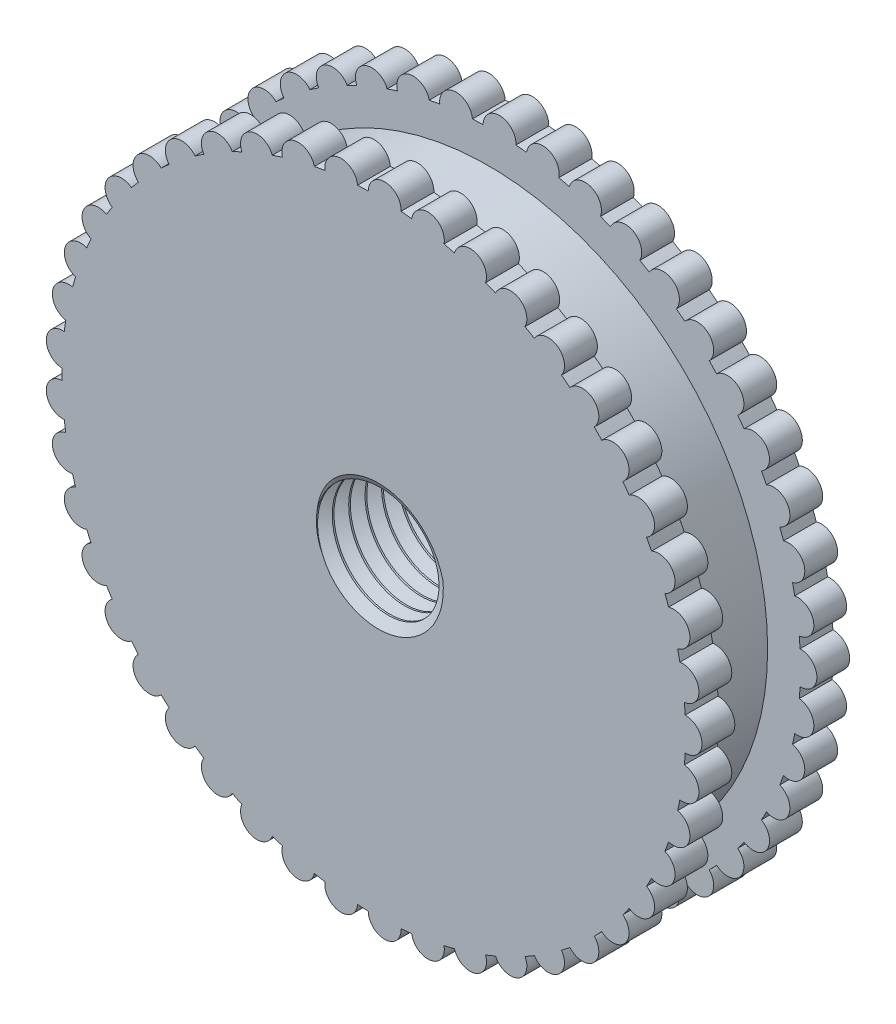
from build123d import *

# Parameters (mm, degrees)
SKETCH1_R               = 9.5
SKETCH1_R_2             = 1.75
BOSS_EXTRUDE1_DEPTH     = 4.5
CUT_SWEEP1_PITCH        = 0.5
CUT_EXTRUDE1_DEPTH      = 1.25
CUT_EXTRUDE1_DEPTH_BACK = 1.25
SKETCH4_R               = 11.115161563
SKETCH4_R_2             = 8.5
BOSS_EXTRUDE2_START     = -1
BOSS_EXTRUDE2_DEPTH     = 1
MIRROR3_OUTLINE_R       = 0.5
MIRROR3_DEPTH           = 3.5
SKETCH6_R               = 18.5
SKETCH6_R_2             = 8.5
CUT_EXTRUDE2_DEPTH      = 2.5


with BuildPart() as part:
    # Sketch1 → Boss-Extrude1 (new body)
    with BuildSketch(Plane.XY):
        Circle(SKETCH1_R)
        Circle(SKETCH1_R_2, mode=Mode.SUBTRACT)
    extrude(amount=BOSS_EXTRUDE1_DEPTH)

    # Cut-Sweep1: arcs per turn and ends read off the stored shape
    # Cut-Sweep1: the profile of Sketch3 screwed along a right-hand helix through 10.666667 turns, 6 arcs to a turn; built about Z, then put on its axis
    cut_sweep1_z = Axis((0, 0, 0), (0, 0, 1))
    cut_sweep1_corners = [(1.721968786, 0.010306382, -0.726649181), (1.721968786, -0.01149805, -0.247144679), (2.13766098, -0.000595834, -0.48689693)]
    with BuildLine(mode=Mode.PRIVATE) as cut_sweep1_profile:
        Line(cut_sweep1_corners[0], cut_sweep1_corners[1])
        Line(cut_sweep1_corners[1], cut_sweep1_corners[2])
        Line(cut_sweep1_corners[2], cut_sweep1_corners[0])
    cut_sweep1_cap = Face(cut_sweep1_profile.wire())
    cut_sweep1_turn_angles = [0, 30, 60, 90, 120, 150, 180, 210, 240, 270, 300, 330, 360]
    cut_sweep1_turn_weights = [1, 0.8660254037844387, 1, 0.8660254037844387, 1, 0.8660254037844387, 1, 0.8660254037844387, 1, 0.8660254037844387, 1, 0.8660254037844387, 1]
    cut_sweep1_turn_rails = [Edge.make_bspline([Vector(p[0], p[1], 0).rotate(cut_sweep1_z, cut_sweep1_turn_angles[k]) / cut_sweep1_turn_weights[k] + Vector(0, 0, p[2] + CUT_SWEEP1_PITCH * cut_sweep1_turn_angles[k] / 360) for k in range(13)], [0, 0, 0, 1, 1, 2, 2, 3, 3, 4, 4, 5, 5, 6, 6, 6], 2, cut_sweep1_turn_weights) for p in cut_sweep1_corners]
    cut_sweep1_turn_sides = [Face.make_surface_from_curves(cut_sweep1_turn_rails[p[0]], cut_sweep1_turn_rails[p[1]]) for p in [(0, 1), (1, 2), (2, 0)]]
    cut_sweep1_last_angles = [3600, 3630, 3660, 3690, 3720, 3750, 3780, 3810, 3840]
    cut_sweep1_last_weights = [1, 0.8660254037844387, 1, 0.8660254037844387, 1, 0.8660254037844387, 1, 0.8660254037844387, 1]
    cut_sweep1_last_rails = [Edge.make_bspline([Vector(p[0], p[1], 0).rotate(cut_sweep1_z, cut_sweep1_last_angles[k]) / cut_sweep1_last_weights[k] + Vector(0, 0, p[2] + CUT_SWEEP1_PITCH * cut_sweep1_last_angles[k] / 360) for k in range(9)], [0, 0, 0, 1, 1, 2, 2, 3, 3, 4, 4, 4], 2, cut_sweep1_last_weights) for p in cut_sweep1_corners]
    cut_sweep1_last_sides = [Face.make_surface_from_curves(cut_sweep1_last_rails[p[0]], cut_sweep1_last_rails[p[1]]) for p in [(0, 1), (1, 2), (2, 0)]]
    cut_sweep1 = Plane(origin=(0, 0, 4.5), x_dir=(1, 0, 0), z_dir=(0, 0, -1)) * Solid(Shell([*[p.moved(Location((0, 0, CUT_SWEEP1_PITCH * i))) for i in range(10) for p in cut_sweep1_turn_sides], *cut_sweep1_last_sides, cut_sweep1_cap, cut_sweep1_cap.rotate(cut_sweep1_z, 3840).moved(Location((0, 0, CUT_SWEEP1_PITCH * 3840 / 360)))]))
    add(cut_sweep1, mode=Mode.SUBTRACT)

    # Sketch4 → Cut-Extrude1 (cut, two sides: drawn at the far end of the back side and taken through both)
    with BuildSketch(Plane.XY.offset(2.25).offset(-CUT_EXTRUDE1_DEPTH_BACK)):
        Circle(SKETCH4_R)
        Circle(SKETCH4_R_2, mode=Mode.SUBTRACT)
    extrude(amount=CUT_EXTRUDE1_DEPTH + CUT_EXTRUDE1_DEPTH_BACK, mode=Mode.SUBTRACT)

    # Boss-Extrude2: read off the stored shape, not the designer's step
    # Boss-Extrude2 outline → Boss-Extrude2 (add)
    with BuildSketch(Plane.XY.offset(4.5).offset(BOSS_EXTRUDE2_START)):
        with BuildLine():
            ThreePointArc((9.486842105, 0.49982684), (9.5, 0), (9.486842105, -0.49982684))
            ThreePointArc((9.486842105, -0.49982684), (10, 0), (9.486842105, 0.49982684))
        make_face()
        with BuildLine():
            ThreePointArc((9.324954359, -1.815275793), (9.902680687, -1.391731009), (9.464079261, -0.825350675))
            ThreePointArc((9.464079261, -0.825350675), (9.407546653, -1.322144459), (9.324954359, -1.815275793))
        make_face()
        with BuildLine():
            ThreePointArc((9.324954359, 1.815275793), (9.407546653, 1.322144459), (9.464079261, 0.825350675))
            ThreePointArc((9.464079261, 0.825350675), (9.902680687, 1.391731009), (9.324954359, 1.815275793))
        make_face()
        with BuildLine():
            ThreePointArc((8.981566983, -3.095392469), (9.612616959, -2.756373558), (9.25710888, -2.134463677))
            ThreePointArc((9.25710888, -2.134463677), (9.131986111, -2.61855488), (8.981566983, -3.095392469))
        make_face()
        with BuildLine():
            ThreePointArc((8.981566983, 3.095392469), (9.131986111, 2.61855488), (9.25710888, 2.134463677))
            ThreePointArc((9.25710888, 2.134463677), (9.612616959, 2.756373558), (8.981566983, 3.095392469))
        make_face()
        with BuildLine():
            ThreePointArc((8.463363622, -4.31526085), (9.135454576, -4.06736643), (8.869959404, -3.402031772))
            ThreePointArc((8.869959404, -3.402031772), (8.678681848, -3.863998109), (8.463363622, -4.31526085))
        make_face()
        with BuildLine():
            ThreePointArc((8.463363622, 4.31526085), (8.678681848, 3.863998109), (8.869959404, 3.402031772))
            ThreePointArc((8.869959404, 3.402031772), (9.135454576, 4.06736643), (8.463363622, 4.31526085))
        make_face()
        with BuildLine():
            ThreePointArc((7.780430515, -5.451137588), (8.480480962, -5.299192642), (8.310166257, -4.603383188))
            ThreePointArc((8.310166257, -4.603383188), (8.056456914, -5.03423301), (7.780430515, -5.451137588))
        make_face()
        with BuildLine():
            ThreePointArc((7.780430515, 5.451137588), (8.056456914, 5.03423301), (8.310166257, 4.603383188))
            ThreePointArc((8.310166257, 4.603383188), (8.480480962, 5.299192642), (7.780430515, 5.451137588))
        make_face()
        with BuildLine():
            ThreePointArc((6.946060178, -6.480914133), (7.660444431, -6.427876097), (7.588625177, -5.715134987))
            ThreePointArc((7.588625177, -5.715134987), (7.27742221, -6.106482292), (6.946060178, -6.480914133))
        make_face()
        with BuildLine():
            ThreePointArc((6.946060178, 6.480914133), (7.27742221, 6.106482292), (7.588625177, 5.715134987))
            ThreePointArc((7.588625177, 5.715134987), (7.660444431, 6.427876097), (6.946060178, 6.480914133))
        make_face()
        with BuildLine():
            ThreePointArc((5.976492681, -7.384547057), (6.691306064, -7.431448255), (6.71938014, -6.715648184))
            ThreePointArc((6.71938014, -6.715648184), (6.356740761, -7.059875842), (5.976492681, -7.384547057))
        make_face()
        with BuildLine():
            ThreePointArc((5.976492681, 7.384547057), (6.356740761, 7.059875842), (6.71938014, 6.715648184))
            ThreePointArc((6.71938014, 6.715648184), (6.691306064, 7.431448255), (5.976492681, 7.384547057))
        make_face()
        with BuildLine():
            ThreePointArc((4.890599552, -8.144448172), (5.591929035, -8.290375726), (5.719350012, -7.585448928))
            ThreePointArc((5.719350012, -7.585448928), (5.312332583, -7.875856939), (4.890599552, -8.144448172))
        make_face()
        with BuildLine():
            ThreePointArc((4.890599552, 8.144448172), (5.312332583, 7.875856939), (5.719350012, 7.585448928))
            ThreePointArc((5.719350012, 7.585448928), (5.591929035, 8.290375726), (4.890599552, 8.144448172))
        make_face()
        with BuildLine():
            ThreePointArc((3.709516465, -8.745826867), (4.383711468, -8.987940463), (4.607999241, -8.307607537))
            ThreePointArc((4.607999241, -8.307607537), (4.164525895, -8.53854344), (3.709516465, -8.745826867))
        make_face()
        with BuildLine():
            ThreePointArc((3.709516465, 8.745826867), (4.164525895, 8.53854344), (4.607999241, 8.307607537))
            ThreePointArc((4.607999241, 8.307607537), (4.383711468, 8.987940463), (3.709516465, 8.745826867))
        make_face()
        with BuildLine():
            ThreePointArc((2.45623186, -9.176977991), (3.090169943, -9.510565163), (3.406959007, -8.868068016))
            ThreePointArc((3.406959007, -8.868068016), (2.935661446, -9.035036905), (2.45623186, -9.176977991))
        make_face()
        with BuildLine():
            ThreePointArc((2.45623186, 9.176977991), (2.935661446, 9.035036905), (3.406959007, 8.868068015))
            ThreePointArc((3.406959007, 8.868068015), (3.090169943, 9.510565163), (2.45623186, 9.176977991))
        make_face()
        with BuildLine():
            ThreePointArc((1.155139496, -9.429509677), (1.736481776, -9.84807753), (2.13960619, -9.255921637))
            ThreePointArc((2.13960619, -9.255921637), (1.649657687, -9.355673654), (1.155139496, -9.429509677))
        make_face()
        with BuildLine():
            ThreePointArc((1.155139496, 9.429509677), (1.649657687, 9.355673654), (2.13960619, 9.255921637))
            ThreePointArc((2.13960619, 9.255921637), (1.736481776, 9.84807753), (1.155139496, 9.429509677))
        make_face()
        with BuildLine():
            ThreePointArc((-0.168436344, -9.498506683), (0.348994968, -9.99390827), (0.830608374, -9.463619272))
            ThreePointArc((0.830608374, -9.463619272), (0.331545219, -9.494212857), (-0.168436344, -9.498506683))
        make_face()
        with BuildLine():
            ThreePointArc((-0.168436344, 9.498506683), (0.331545219, 9.494212857), (0.830608374, 9.463619272))
            ThreePointArc((0.830608374, 9.463619272), (0.348994968, 9.99390827), (-0.168436344, 9.498506683))
        make_face()
        with BuildLine():
            ThreePointArc((-1.488733763, -9.38262606), (-1.045284633, -9.945218954), (-0.49455629, -9.487118323))
            ThreePointArc((-0.49455629, -9.487118323), (-0.993020401, -9.447958006), (-1.488733763, -9.38262606))
        make_face()
        with BuildLine():
            ThreePointArc((-1.488733763, 9.38262606), (-0.993020401, 9.447958006), (-0.49455629, 9.487118323))
            ThreePointArc((-0.49455629, 9.487118323), (-1.045284633, 9.945218954), (-1.488733763, 9.38262606))
        make_face()
        with BuildLine():
            ThreePointArc((-2.780054672, -9.084123294), (-2.419218956, -9.702957263), (-1.810094979, -9.325961407))
            ThreePointArc((-1.810094979, -9.325961407), (-2.298258008, -9.2178094), (-2.780054672, -9.084123294))
        make_face()
        with BuildLine():
            ThreePointArc((-2.780054672, 9.084123294), (-2.298258008, 9.2178094), (-1.810094979, 9.325961407))
            ThreePointArc((-1.810094979, 9.325961407), (-2.419218956, 9.702957263), (-2.780054672, 9.084123294))
        make_face()
        with BuildLine():
            ThreePointArc((-4.017264979, -8.608808401), (-3.746065934, -9.271838546), (-3.090402227, -8.983285261))
            ThreePointArc((-3.090402227, -8.983285261), (-3.558762637, -8.808246619), (-4.017264979, -8.608808401))
        make_face()
        with BuildLine():
            ThreePointArc((-4.017264979, 8.608808401), (-3.558762637, 8.808246619), (-3.090402227, 8.983285261))
            ThreePointArc((-3.090402227, 8.983285261), (-3.746065934, 9.271838546), (-4.017264979, 8.608808401))
        make_face()
        with BuildLine():
            ThreePointArc((-5.176283793, -7.965932845), (-5, -8.660254038), (-4.310558312, -8.465759685))
            ThreePointArc((-4.310558312, -8.465759685), (-4.75, -8.227241336), (-5.176283793, -7.965932845))
        make_face()
        with BuildLine():
            ThreePointArc((-5.176283793, 7.965932845), (-4.75, 8.227241336), (-4.310558312, 8.465759685))
            ThreePointArc((-4.310558312, 8.465759685), (-5, 8.660254038), (-5.176283793, 7.965932845))
        make_face()
        with BuildLine():
            ThreePointArc((-6.234552131, -7.168009467), (-6.156614753, -7.880107536), (-5.446814282, -7.783457726))
            ThreePointArc((-5.446814282, -7.783457726), (-5.848784016, -7.486102159), (-6.234552131, -7.168009467))
        make_face()
        with BuildLine():
            ThreePointArc((-6.234552131, 7.168009467), (-5.848784016, 7.486102159), (-5.446814282, 7.783457726))
            ThreePointArc((-5.446814282, 7.783457726), (-6.156614753, 7.880107536), (-6.234552131, 7.168009467))
        make_face()
        with BuildLine():
            ThreePointArc((-7.171472004, -6.230568938), (-7.193398004, -6.946583704), (-6.477054208, -6.949659617))
            ThreePointArc((-6.477054208, -6.949659617), (-6.833728103, -6.599254519), (-7.171472004, -6.230568938))
        make_face()
        with BuildLine():
            ThreePointArc((-7.171472004, 6.230568938), (-6.833728103, 6.599254519), (-6.477054208, 6.949659617))
            ThreePointArc((-6.477054208, 6.949659617), (-7.193398004, 6.946583704), (-7.171472004, 6.230568938))
        make_face()
        with BuildLine():
            ThreePointArc((-7.968807331, -5.171857473), (-8.090169944, -5.877852523), (-7.381225641, -5.980594288))
            ThreePointArc((-7.381225641, -5.980594288), (-7.685661446, -5.583959897), (-7.968807331, -5.171857473))
        make_face()
        with BuildLine():
            ThreePointArc((-7.968807331, 5.171857473), (-7.685661446, 5.583959897), (-7.381225641, 5.980594288))
            ThreePointArc((-7.381225641, 5.980594288), (-8.090169944, 5.877852523), (-7.968807331, 5.171857473))
        make_face()
        with BuildLine():
            ThreePointArc((-8.611038888, -4.012481684), (-8.829475929, -4.694715628), (-8.141729913, -4.895123494))
            ThreePointArc((-8.141729913, -4.895123494), (-8.388002132, -4.459979846), (-8.611038888, -4.012481684))
        make_face()
        with BuildLine():
            ThreePointArc((-8.611038888, 4.012481684), (-8.388002132, 4.459979846), (-8.141729913, 4.895123494))
            ThreePointArc((-8.141729913, 4.895123494), (-8.829475929, 4.694715628), (-8.611038888, 4.012481684))
        make_face()
        with BuildLine():
            ThreePointArc((-9.085666368, -2.775007503), (-9.396926208, -3.420201433), (-8.743764673, -3.71437469))
            ThreePointArc((-8.743764673, -3.71437469), (-8.927079897, -3.249191362), (-9.085666368, -2.775007503))
        make_face()
        with BuildLine():
            ThreePointArc((-9.085666368, 2.775007503), (-8.927079897, 3.249191362), (-8.743764673, 3.71437469))
            ThreePointArc((-8.743764673, 3.71437469), (-9.396926208, 3.420201433), (-9.085666368, 2.775007503))
        make_face()
        with BuildLine():
            ThreePointArc((-9.383451687, -1.483520958), (-9.781476007, -2.079116908), (-9.175612, -2.461329807))
            ThreePointArc((-9.175612, -2.461329807), (-9.292402207, -1.975161063), (-9.383451687, -1.483520958))
        make_face()
        with BuildLine():
            ThreePointArc((-9.383451687, 1.483520958), (-9.292402207, 1.975161063), (-9.175612, 2.461329807))
            ThreePointArc((-9.175612, 2.461329807), (-9.781476007, 2.079116908), (-9.383451687, 1.483520958))
        make_face()
        with BuildLine():
            ThreePointArc((-9.498598793, -0.163159365), (-9.975640503, -0.697564737), (-9.428866477, -1.160377939))
            ThreePointArc((-9.428866477, -1.160377939), (-9.476858477, -0.6626865), (-9.498598793, -0.163159365))
        make_face()
        with BuildLine():
            ThreePointArc((-9.498598793, 0.163159365), (-9.476858477, 0.6626865), (-9.428866477, 1.160377939))
            ThreePointArc((-9.428866477, 1.160377939), (-9.975640503, 0.697564737), (-9.498598793, 0.163159365))
        make_face()
    extrude(amount=BOSS_EXTRUDE2_DEPTH)

    # Mirror3: read off the stored shape, not the designer's step
    # Mirror3 outline → Mirror3 (add)
    with BuildSketch(Plane.XY):
        with Locations((9.5, 0)):
            Circle(MIRROR3_OUTLINE_R)
        with Locations((9.407546653, 1.322144459)):
            Circle(MIRROR3_OUTLINE_R)
        with Locations((9.407546653, -1.322144459)):
            Circle(MIRROR3_OUTLINE_R)
        with Locations((9.131986111, 2.61855488)):
            Circle(MIRROR3_OUTLINE_R)
        with Locations((9.131986111, -2.61855488)):
            Circle(MIRROR3_OUTLINE_R)
        with Locations((8.678681848, 3.863998109)):
            Circle(MIRROR3_OUTLINE_R)
        with Locations((8.678681848, -3.863998109)):
            Circle(MIRROR3_OUTLINE_R)
        with Locations((8.056456913, 5.03423301)):
            Circle(MIRROR3_OUTLINE_R)
        with Locations((8.056456913, -5.03423301)):
            Circle(MIRROR3_OUTLINE_R)
        with Locations((7.27742221, 6.106482292)):
            Circle(MIRROR3_OUTLINE_R)
        with Locations((7.27742221, -6.106482292)):
            Circle(MIRROR3_OUTLINE_R)
        with Locations((6.35674076, 7.059875842)):
            Circle(MIRROR3_OUTLINE_R)
        with Locations((6.35674076, -7.059875842)):
            Circle(MIRROR3_OUTLINE_R)
        with Locations((5.312332583, 7.875856939)):
            Circle(MIRROR3_OUTLINE_R)
        with Locations((5.312332583, -7.875856939)):
            Circle(MIRROR3_OUTLINE_R)
        with Locations((4.164525894, 8.53854344)):
            Circle(MIRROR3_OUTLINE_R)
        with Locations((4.164525894, -8.53854344)):
            Circle(MIRROR3_OUTLINE_R)
        with Locations((2.935661447, 9.035036905)):
            Circle(MIRROR3_OUTLINE_R)
        with Locations((2.935661447, -9.035036905)):
            Circle(MIRROR3_OUTLINE_R)
        with Locations((1.649657688, 9.355673654)):
            Circle(MIRROR3_OUTLINE_R)
        with Locations((1.649657688, -9.355673654)):
            Circle(MIRROR3_OUTLINE_R)
        with Locations((0.331545219, 9.494212857)):
            Circle(MIRROR3_OUTLINE_R)
        with Locations((0.331545219, -9.494212857)):
            Circle(MIRROR3_OUTLINE_R)
        with Locations((-0.993020401, 9.447958006)):
            Circle(MIRROR3_OUTLINE_R)
        with Locations((-0.993020401, -9.447958006)):
            Circle(MIRROR3_OUTLINE_R)
        with Locations((-2.298258008, 9.2178094)):
            Circle(MIRROR3_OUTLINE_R)
        with Locations((-2.298258008, -9.2178094)):
            Circle(MIRROR3_OUTLINE_R)
        with Locations((-3.558762637, 8.808246618)):
            Circle(MIRROR3_OUTLINE_R)
        with Locations((-3.558762637, -8.808246618)):
            Circle(MIRROR3_OUTLINE_R)
        with Locations((-4.75, 8.227241336)):
            Circle(MIRROR3_OUTLINE_R)
        with Locations((-4.75, -8.227241336)):
            Circle(MIRROR3_OUTLINE_R)
        with Locations((-5.848784016, 7.486102159)):
            Circle(MIRROR3_OUTLINE_R)
        with Locations((-5.848784016, -7.486102159)):
            Circle(MIRROR3_OUTLINE_R)
        with Locations((-6.833728103, 6.599254519)):
            Circle(MIRROR3_OUTLINE_R)
        with Locations((-6.833728103, -6.599254519)):
            Circle(MIRROR3_OUTLINE_R)
        with Locations((-7.685661447, 5.583959897)):
            Circle(MIRROR3_OUTLINE_R)
        with Locations((-7.685661447, -5.583959897)):
            Circle(MIRROR3_OUTLINE_R)
        with Locations((-8.388002132, 4.459979846)):
            Circle(MIRROR3_OUTLINE_R)
        with Locations((-8.388002132, -4.459979846)):
            Circle(MIRROR3_OUTLINE_R)
        with Locations((-8.927079897, 3.249191362)):
            Circle(MIRROR3_OUTLINE_R)
        with Locations((-8.927079897, -3.249191362)):
            Circle(MIRROR3_OUTLINE_R)
        with Locations((-9.292402207, 1.975161063)):
            Circle(MIRROR3_OUTLINE_R)
        with Locations((-9.292402207, -1.975161063)):
            Circle(MIRROR3_OUTLINE_R)
        with Locations((-9.476858477, 0.662686501)):
            Circle(MIRROR3_OUTLINE_R)
        with Locations((-9.476858477, -0.662686501)):
            Circle(MIRROR3_OUTLINE_R)
    extrude(amount=MIRROR3_DEPTH)

    # Sketch6 → Cut-Extrude2 (cut)
    with BuildSketch(Plane(origin=(0, 0, 3.5), x_dir=(-1, 0, 0), z_dir=(0, 0, -1))):
        Circle(SKETCH6_R)
        with Locations(Location((0, 0, 0), (0, 0, 180))):
            Circle(SKETCH6_R_2, mode=Mode.SUBTRACT)
    extrude(amount=CUT_EXTRUDE2_DEPTH, mode=Mode.SUBTRACT)


solid = part.part
